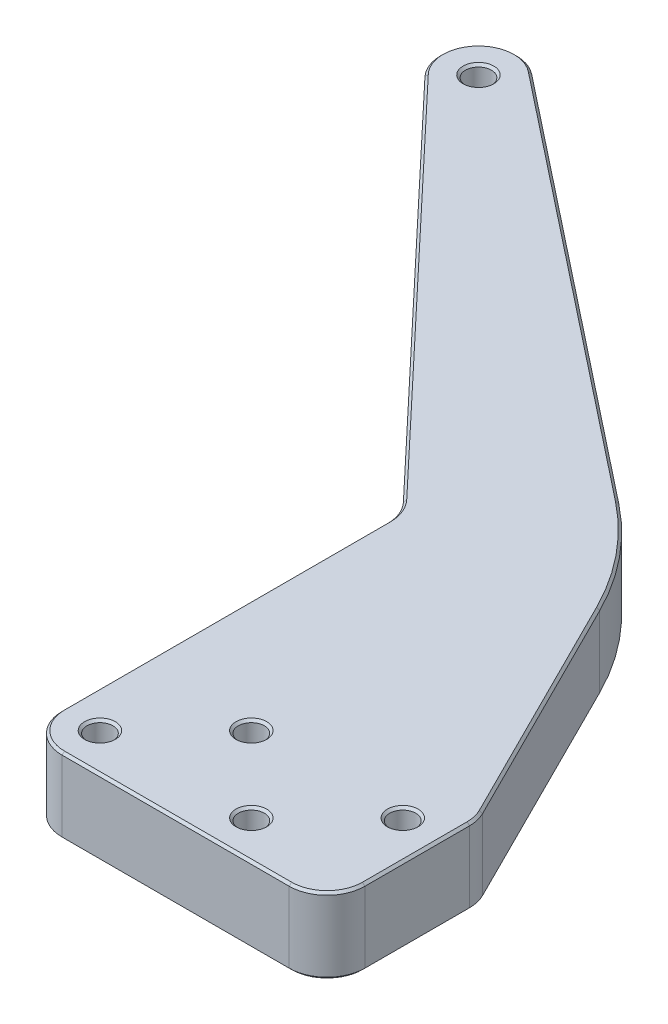
from build123d import *

# Parameters (mm, degrees)
SKETCH1_R           = 2.1828125
BOSS_EXTRUDE1_DEPTH = 12.7
CHAMFER1_SIZE       = 0.396875


with BuildPart() as part:
    # Sketch1 → Boss-Extrude1 (new body)
    with BuildSketch(Plane(origin=(0, 0, 0), x_dir=(1, 0, 0), z_dir=(0, 1, 0))):
        with BuildLine():
            Line((-6.35, 0), (-6.35, 54.62790154))
            ThreePointArc((-6.35, 54.62790154), (-6.798453463, 56.971882868), (-8.080471958, 58.98478812))
            Line((-8.080471958, 58.98478812), (-68.119528042, 122.64311342))
            ThreePointArc((-68.119528042, 122.64311342), (-68.181815181, 131.289884219), (-59.562552845, 131.981868113))
            Line((-59.562552845, 131.981868113), (10.172884133, 76.866077869))
            ThreePointArc((10.172884133, 76.866077869), (18.084222784, 69.06452137), (24.110208193, 59.729583614))
            Line((24.110208193, 59.729583614), (43.779612663, 20.390774674))
            ThreePointArc((43.779612663, 20.390774674), (44.280131083, 19.009899388), (44.45, 17.550968343))
            Line((44.45, 17.550968343), (44.45, 0))
            ThreePointArc((44.45, 0), (42.590128061, -4.490128061), (38.1, -6.35))
            Line((38.1, -6.35), (0, -6.35))
            ThreePointArc((0, -6.35), (-4.490128061, -4.490128061), (-6.35, 0))
        make_face()
        Circle(SKETCH1_R, mode=Mode.SUBTRACT)
        with Locations((12.7, 12.7)):
            Circle(SKETCH1_R, mode=Mode.SUBTRACT)
        with Locations((25.4, 0)):
            Circle(SKETCH1_R, mode=Mode.SUBTRACT)
        with Locations((38.1, 12.7)):
            Circle(SKETCH1_R, mode=Mode.SUBTRACT)
        with Locations((-63.5, 127)):
            Circle(SKETCH1_R, mode=Mode.SUBTRACT)
    extrude(amount=BOSS_EXTRUDE1_DEPTH)

    # Chamfer1
    chamfer1_edges = [part.edges().sort_by_distance(p)[0] for p in [
        (-65.6828125, 0, -127),
        (35.9171875, 0, -12.7),
        (23.2171875, 0, 0),
        (10.5171875, 0, -12.7),
        (-2.1828125, 0, 0),
        (-6.35, 0, -27.31395077),
        (-4.490128061, 0, 4.490128061),
        (19.05, 0, 6.35),
        (42.590128061, 0, 4.490128061),
        (44.45, 0, -8.775484171),
        (44.280131083, 0, -19.009899388),
        (33.944910428, 0, -40.060179144),
        (18.084222784, 0, -69.06452137),
        (-24.694834356, 0, -104.423972991),
        (-68.181815181, 0, -131.289884219),
        (-38.1, 0, -90.81395077),
        (-6.798453463, 0, -56.971882868),
        (-65.6828125, 12.7, -127),
        (23.2171875, 12.7, 0),
        (-2.1828125, 12.7, 0),
        (-38.1, 12.7, -90.81395077),
        (-68.181815181, 12.7, -131.289884219),
        (-24.694834356, 12.7, -104.423972991),
        (18.084222784, 12.7, -69.06452137),
        (33.944910428, 12.7, -40.060179144),
        (44.280131083, 12.7, -19.009899388),
        (44.45, 12.7, -8.775484171),
        (42.590128061, 12.7, 4.490128061),
        (19.05, 12.7, 6.35),
        (-4.490128061, 12.7, 4.490128061),
        (-6.35, 12.7, -27.31395077),
        (-6.798453463, 12.7, -56.971882868),
        (10.5171875, 12.7, -12.7),
        (35.9171875, 12.7, -12.7),
    ]]
    chamfer(chamfer1_edges, length=CHAMFER1_SIZE)


solid = part.part
